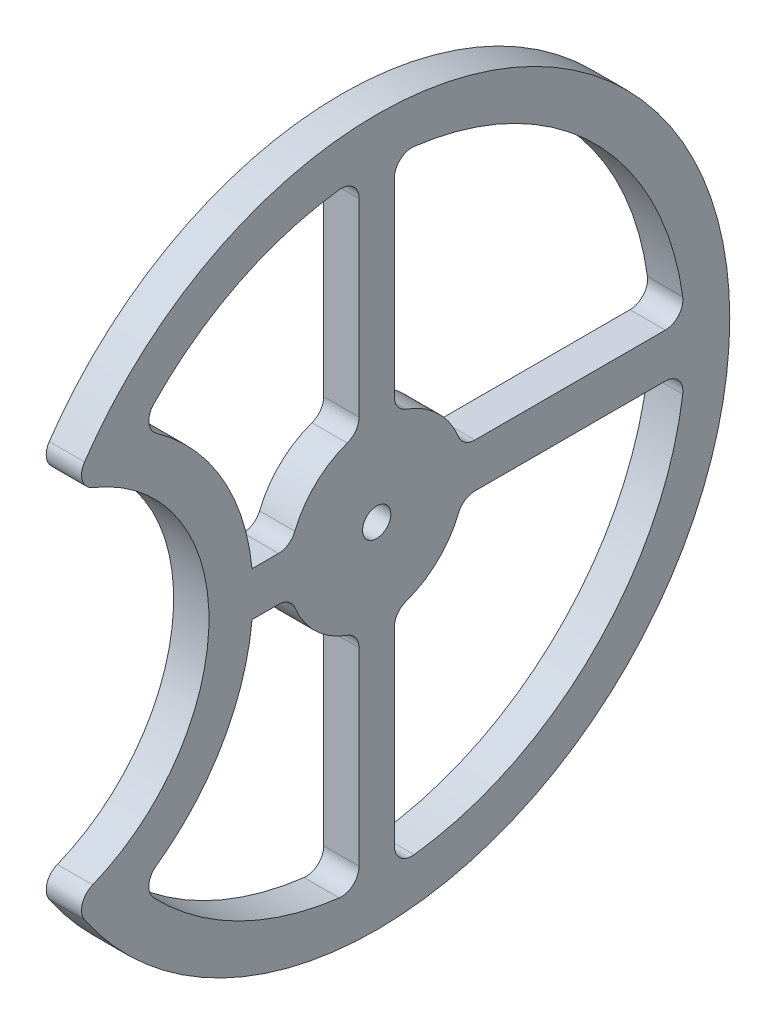
from build123d import *

# Parameters (mm, degrees)
SKETCH1_R           = 1.6
BOSS_EXTRUDE1_DEPTH = 4
FILLET1_R           = 2


with BuildPart() as part:
    # Sketch1 → Boss-Extrude1 (new body)
    with BuildSketch(Plane(origin=(0, 0, 0), x_dir=(0, 0, -1), z_dir=(1, 0, 0))):
        with BuildLine():
            ThreePointArc((-34.4875, 20.263571841), (-19, 0), (-34.4875, -20.263571841))
            ThreePointArc((-34.4875, -20.263571841), (40, 0), (-34.4875, 20.263571841))
        make_face()
        with BuildLine():
            ThreePointArc((-26.8625, 22.436713078), (-15.727733284, 31.267209753), (-2, 34.942810419))
            Line((-2, 34.942810419), (-2, 9.797958971))
            ThreePointArc((-2, 9.797958971), (-6.887307867, 7.250171746), (-9.682458366, 2.5))
            Line((-9.682458366, 2.5), (-14.120471411, 2.5))
            ThreePointArc((-14.120471411, 2.5), (-18.092232837, 14.001776242), (-26.8625, 22.436713078))
        make_face(mode=Mode.SUBTRACT)
        with BuildLine():
            ThreePointArc((-26.8625, -22.436713078), (-18.092232837, -14.001776242), (-14.120471411, -2.5))
            Line((-14.120471411, -2.5), (-9.682458366, -2.5))
            ThreePointArc((-9.682458366, -2.5), (-6.887307867, -7.250171746), (-2, -9.797958971))
            Line((-2, -9.797958971), (-2, -34.942810419))
            ThreePointArc((-2, -34.942810419), (-15.727733284, -31.267209753), (-26.8625, -22.436713078))
        make_face(mode=Mode.SUBTRACT)
        with BuildLine():
            Line((2, -34.942810419), (2, -9.797958971))
            ThreePointArc((2, -9.797958971), (6.887307867, -7.250171746), (9.682458366, -2.5))
            Line((9.682458366, -2.5), (34.910600109, -2.5))
            ThreePointArc((34.910600109, -2.5), (24.570960239, -24.925246497), (2, -34.942810419))
        make_face(mode=Mode.SUBTRACT)
        with BuildLine():
            ThreePointArc((2, 34.942810419), (24.570960239, 24.925246497), (34.910600109, 2.5))
            Line((34.910600109, 2.5), (9.682458366, 2.5))
            ThreePointArc((9.682458366, 2.5), (6.887307867, 7.250171746), (2, 9.797958971))
            Line((2, 9.797958971), (2, 34.942810419))
        make_face(mode=Mode.SUBTRACT)
        Circle(SKETCH1_R, mode=Mode.SUBTRACT)
    extrude(amount=BOSS_EXTRUDE1_DEPTH)

    # Fillet1
    fillet1_edges = [part.edges().sort_by_distance(p)[0] for p in [
        (2, 2.5, 9.682458366),
        (2, -2.5, 9.682458366),
        (2, -9.797958971, 2),
        (2, -34.942810419, -2),
        (2, -34.942810419, 2),
        (2, -22.436713078, 26.8625),
        (2, 22.436713078, 26.8625),
        (2, 9.797958971, 2),
        (2, 9.797958971, -2),
        (2, 2.5, -9.682458366),
        (2, -2.5, -9.682458366),
        (2, -9.797958971, -2),
        (2, -2.5, -34.910600109),
        (2, 2.5, -34.910600109),
        (2, 34.942810419, -2),
        (2, 34.942810419, 2),
        (2, 20.263571841, 34.4875),
        (2, -20.263571841, 34.4875),
    ]]
    fillet(fillet1_edges, radius=FILLET1_R)


solid = part.part
